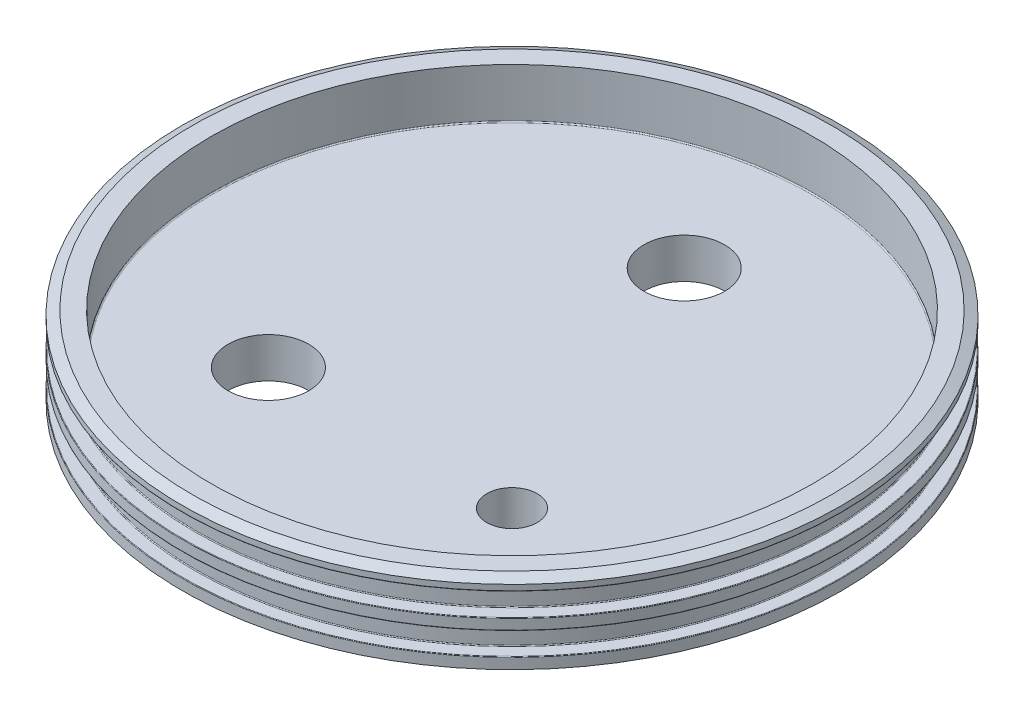
from build123d import *

# Parameters (mm, degrees)
SKETCH6_R                                = 66.04
BOSS_EXTRUDE1_DEPTH                      = 2.54
CNC_ID_FILLET_R                          = 0.1778
CNC_OD_FILLET_R                          = 0.127
CNC_CHAMFERS_SIZE                        = 1.016
CNC_CHAMFERS_SIZE2                       = 2.178819031
CNC_BORE_FILLET_R                        = 0.254
PIPE_TAP_DRILL_FOR_1_2_TAP_FILL_VALVE_D  = 17.8562
PIPE_TAP_DRILL_FOR_1_4_TAP_SOLENOID_VA_D = 11.1252
PIPE_TAP_DRILL_FOR_1_2_TAP_CRYO_VALVE_D  = 17.8562


with BuildPart() as part:
    # Sketch1 → Revolve1 (revolve)
    with BuildSketch(Plane.XY):
        Polygon((0, 0), (72.898, 0), (72.898, 2.4638), (69.977, 2.4638), (69.977, 7.4422), (72.898, 7.4422), (72.898, 9.906), (69.977, 9.906), (69.977, 14.986), (72.898, 14.986), (72.898, 17.3482), (66.548, 17.3482), (66.548, 6.35), (0, 6.35), align=None)
    revolve(axis=Axis((0, 48.192213231, 0), (0, -1, 0)))

    # Sketch6 → Boss-Extrude1 (add)
    with BuildSketch(Plane.XZ):
        Circle(SKETCH6_R)
    extrude(amount=BOSS_EXTRUDE1_DEPTH)

    # CNC ID Fillet
    cnc_id_fillet_edges = [part.edges().sort_by_distance(p)[0] for p in [
        (-69.977, 7.4422, 0),
        (-69.977, 2.4638, 0),
        (-66.04, 0, 0),
        (-69.977, 14.986, 0),
        (-69.977, 9.906, 0),
    ]]
    fillet(cnc_id_fillet_edges, radius=CNC_ID_FILLET_R)

    # CNC OD Fillet
    cnc_od_fillet_edges = [part.edges().sort_by_distance(p)[0] for p in [
        (-72.898, 7.4422, 0),
        (-72.898, 2.4638, 0),
        (-72.898, 9.906, 0),
        (-72.898, 14.986, 0),
        (-66.04, -2.54, 0),
    ]]
    fillet(cnc_od_fillet_edges, radius=CNC_OD_FILLET_R)

    # CNC Chamfers
    cnc_chamfers_edges = [part.edges().sort_by_distance(p)[0] for p in [
        (-72.898, 17.3482, 0),
    ]]
    cnc_chamfers_side = [part.faces().sort_by_distance(p)[0] for p in [
        (-72.898, 16.2306, 0),
    ]]
    chamfer(cnc_chamfers_edges, length=CNC_CHAMFERS_SIZE, length2=CNC_CHAMFERS_SIZE2, reference=cnc_chamfers_side[0])

    # CNC Bore Fillet
    cnc_bore_fillet_edges = [part.edges().sort_by_distance(p)[0] for p in [
        (-66.548, 6.35, 0),
    ]]
    fillet(cnc_bore_fillet_edges, radius=CNC_BORE_FILLET_R)

    # Pipe Tap Drill for 1/2 Tap - Fill Valve (through all)
    with Locations(Plane(origin=(0, -2.54, 0), x_dir=(-1, 0, 0), z_dir=(0, -1, 0))):
        with Locations((0, 38.1)):
            Hole(PIPE_TAP_DRILL_FOR_1_2_TAP_FILL_VALVE_D / 2)

    # Pipe Tap Drill for 1/4 Tap - Solenoid Valve (through all)
    with Locations(Plane(origin=(0, -2.54, 0), x_dir=(-1, 0, 0), z_dir=(0, -1, 0))):
        with Locations((-26.940768363, -26.940768363)):
            Hole(PIPE_TAP_DRILL_FOR_1_4_TAP_SOLENOID_VA_D / 2)

    # Pipe Tap Drill for 1/2 Tap - Cryo Valve (through all)
    with Locations(Plane(origin=(0, -2.54, 0), x_dir=(-1, 0, 0), z_dir=(0, -1, 0))):
        with Locations((26.940768363, -26.940768363)):
            Hole(PIPE_TAP_DRILL_FOR_1_2_TAP_CRYO_VALVE_D / 2)


solid = part.part
